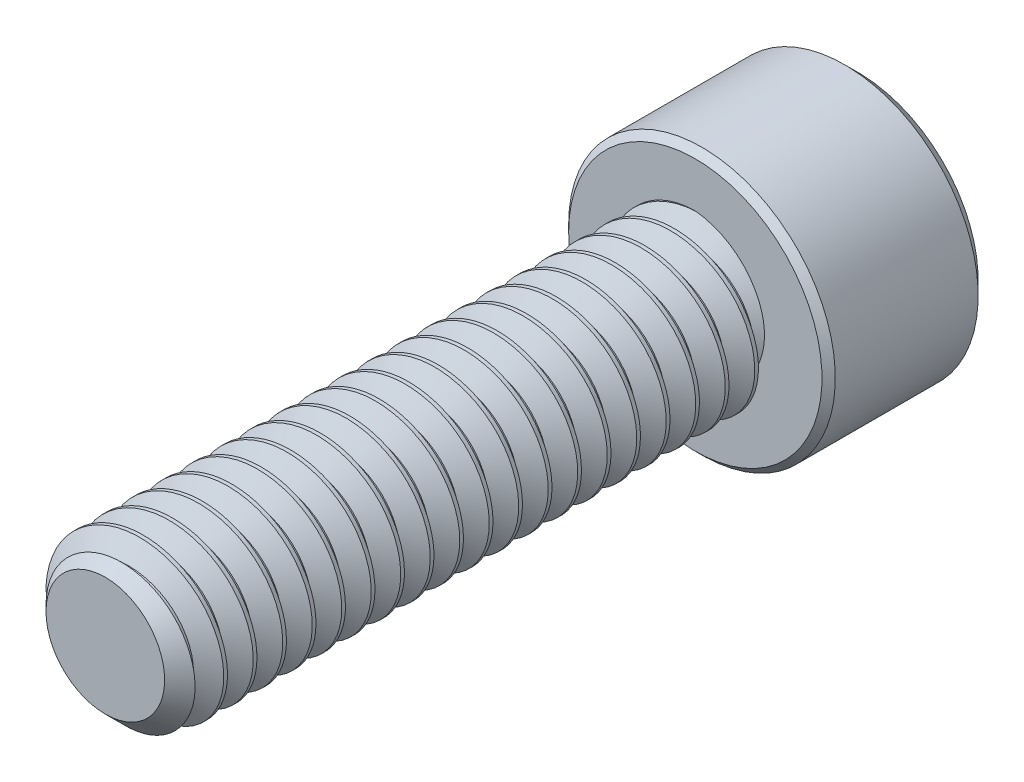
from build123d import *

# Parameters (mm, degrees)
SKETCH1_R          = 1.7526
EXTRUDE1_DEPTH     = 12.7
CHAMFER3_SIZE      = 0.47625
CUT_SWEEP1_PITCH   = 0.635
SKETCH6_R          = 2.8702
EXTRUDE2_DEPTH     = 3.5052
CUT_EXTRUDE1_DEPTH = 2.08359375
CHAMFER1_SIZE      = 0.28702
CHAMFER2_SIZE      = 0.14351


with BuildPart() as part:
    # Sketch1 → Extrude1 (new body)
    with BuildSketch(Plane.XY):
        Circle(SKETCH1_R)
    extrude(amount=-EXTRUDE1_DEPTH)

    # Chamfer3
    chamfer3_edges = [part.edges().sort_by_distance(p)[0] for p in [
        (-1.7526, 0, 0),
    ]]
    chamfer(chamfer3_edges, length=CHAMFER3_SIZE)

    # Cut-Sweep1: the profile of Sketch3 profile screwed along a right-hand helix of 21 turns, 6 arcs to a turn; built about Z, then put on its axis
    cut_sweep1_z = Axis((0, 0, 0), (0, 0, 1))
    cut_sweep1_corners = [(1.7529, 0, -0.555798205), (1.340155401, 0, -0.3175), (1.340155401, 0, -0.238125), (1.7529, 0, 0.000173205)]
    with BuildLine(mode=Mode.PRIVATE) as cut_sweep1_profile:
        Line(cut_sweep1_corners[0], cut_sweep1_corners[1])
        Line(cut_sweep1_corners[1], cut_sweep1_corners[2])
        Line(cut_sweep1_corners[2], cut_sweep1_corners[3])
        Line(cut_sweep1_corners[3], cut_sweep1_corners[0])
    cut_sweep1_cap = Face(cut_sweep1_profile.wire())
    cut_sweep1_turn_angles = [0, 30, 60, 90, 120, 150, 180, 210, 240, 270, 300, 330, 360]
    cut_sweep1_turn_weights = [1, 0.8660254037844387, 1, 0.8660254037844387, 1, 0.8660254037844387, 1, 0.8660254037844387, 1, 0.8660254037844387, 1, 0.8660254037844387, 1]
    cut_sweep1_turn_rails = [Edge.make_bspline([Vector(p[0], p[1], 0).rotate(cut_sweep1_z, cut_sweep1_turn_angles[k]) / cut_sweep1_turn_weights[k] + Vector(0, 0, p[2] + CUT_SWEEP1_PITCH * cut_sweep1_turn_angles[k] / 360) for k in range(13)], [0, 0, 0, 1, 1, 2, 2, 3, 3, 4, 4, 5, 5, 6, 6, 6], 2, cut_sweep1_turn_weights) for p in cut_sweep1_corners]
    cut_sweep1_turn_sides = [Face.make_surface_from_curves(cut_sweep1_turn_rails[p[0]], cut_sweep1_turn_rails[p[1]]) for p in [(0, 1), (1, 2), (2, 3), (3, 0)]]
    cut_sweep1 = Plane(origin=(0, 0, 0), x_dir=(0, 1, 0), z_dir=(0, 0, -1)) * Solid(Shell([*[p.moved(Location((0, 0, CUT_SWEEP1_PITCH * i))) for i in range(21) for p in cut_sweep1_turn_sides], cut_sweep1_cap, cut_sweep1_cap.rotate(cut_sweep1_z, 7560).moved(Location((0, 0, CUT_SWEEP1_PITCH * 7560 / 360)))]))
    add(cut_sweep1, mode=Mode.SUBTRACT)

    # Sketch6 → Extrude2 (add)
    with BuildSketch(Plane(origin=(0, 0, -12.7), x_dir=(-1, 0, 0), z_dir=(0, 0, -1))):
        Circle(SKETCH6_R)
    extrude(amount=EXTRUDE2_DEPTH)

    # Sketch7 → Cut-Extrude1 (cut)
    with BuildSketch(Plane(origin=(0, 0, -16.2052), x_dir=(-1, 0, 0), z_dir=(0, 0, -1))):
        Polygon((0, 1.603951217), (-1.3890625, 0.801975608), (-1.3890625, -0.801975608), (0, -1.603951217), (1.3890625, -0.801975608), (1.3890625, 0.801975608), align=None)
    extrude(amount=-CUT_EXTRUDE1_DEPTH, mode=Mode.SUBTRACT)

    # Cut-Extrude2 cone 1 section (through the dimple's axis) → Cut-Extrude2 (revolve, cut)
    with BuildSketch(Plane(origin=(0, 0, -16.2052), x_dir=(0, 1, 0), z_dir=(1, 0, 0))):
        Polygon((0, 0), (1.603951217, 0), (0, 1.603951217), align=None)
    revolve(axis=Axis((0, 0, -16.2052), (0, 0, 1)), mode=Mode.SUBTRACT)

    # Chamfer1
    chamfer1_edges = [part.edges().sort_by_distance(p)[0] for p in [
        (2.8702, 0, -16.2052),
    ]]
    chamfer(chamfer1_edges, length=CHAMFER1_SIZE)

    # Chamfer2
    chamfer2_edges = [part.edges().sort_by_distance(p)[0] for p in [
        (2.8702, 0, -12.7),
    ]]
    chamfer(chamfer2_edges, length=CHAMFER2_SIZE)


solid = part.part
